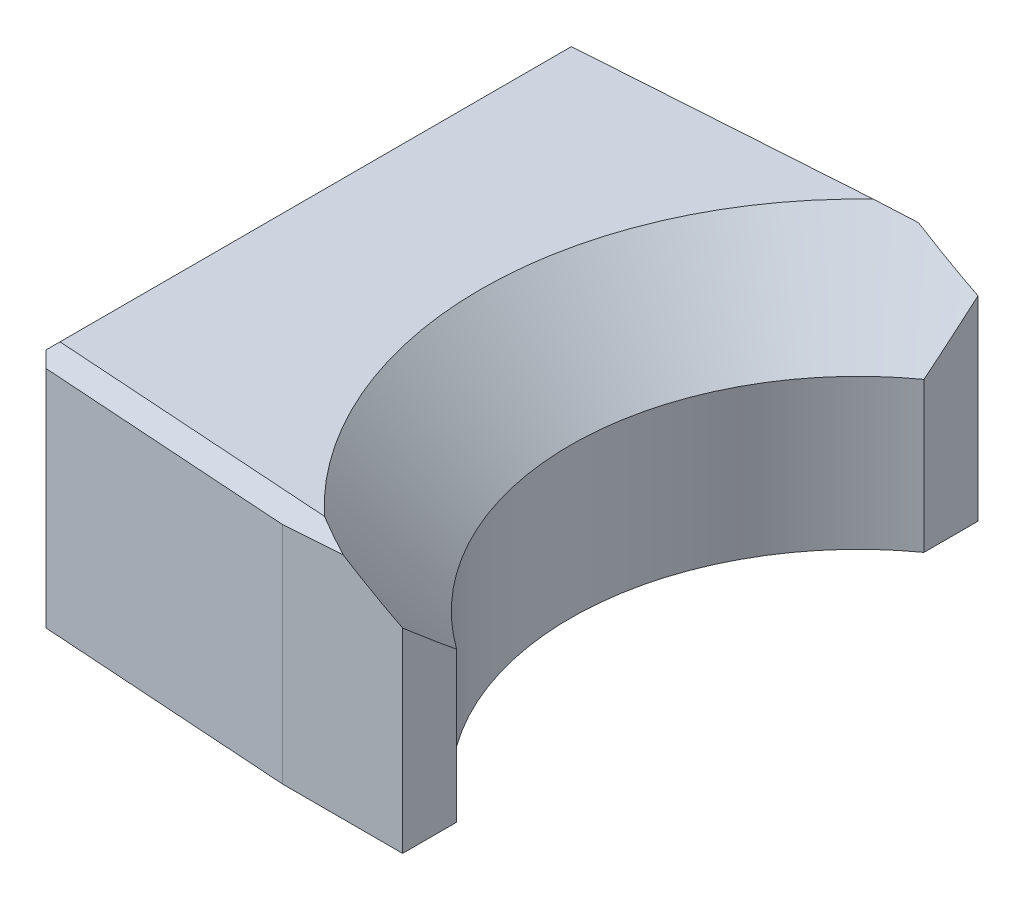
from build123d import *
from OCP.BRepFilletAPI import BRepFilletAPI_MakeChamfer

# Parameters (mm, degrees)
BOSS_EXTRUDE2_DEPTH       = 40
CHAMFER1_SIZE             = 15
CHAMFER3_SIZE             = 2.5
CHAMFER3_SIZE2            = 2.68451721
M4X0_7_TAPPED_HOLE1_D     = 3.3
M4X0_7_TAPPED_HOLE1_DEPTH = 10.1
M4X0_7_TAPPED_HOLE1_TIP   = 0.991420021
SKETCH4_R                 = 11.5
CUT_EXTRUDE1_DEPTH        = 30
M6X1_0_TAPPED_HOLE1_D     = 5
M6X1_0_TAPPED_HOLE1_DEPTH = 15
M6X1_0_TAPPED_HOLE1_TIP   = 1.502151548


with BuildPart() as part:
    # Sketch1 → Boss-Extrude2 (new body)
    with BuildSketch(Plane(origin=(0, 0, 0), x_dir=(1, 0, 0), z_dir=(0, 1, 0))):
        with BuildLine():
            Line((-28, 48), (-48, 48))
            Line((-48, 48), (-93, 45))
            Line((-93, 45), (-93, -45))
            Line((-93, -45), (-48, -48))
            Line((-48, -48), (-28, -48))
            Line((-28, -48), (-28, -38.987177379))
            ThreePointArc((-28, -38.987177379), (-48, 0), (-28, 38.987177379))
            Line((-28, 38.987177379), (-28, 48))
        make_face()
    extrude(amount=BOSS_EXTRUDE2_DEPTH)

    # Chamfer1
    chamfer1_edges = [part.edges().sort_by_distance(p)[0] for p in [
        (-48, 40, 0),
    ]]
    chamfer(chamfer1_edges, length=CHAMFER1_SIZE)

    # Chamfer2
    # the kernel refuses this chamfer: 2.5 mm, written as the material it takes off along each edge
    with BuildSketch(Plane(origin=(-32.604077303, 40, -49.026394846), x_dir=(0.06649386081081782, 0.027495876610587725, 0.9974079121622642), z_dir=(-0.997785157856609, 0, 0.06651901052377412)), Plane(origin=(-108.395922697, 40, 43.973605154), x_dir=(0.06649386081081746, 0.02749587661058773, -0.9974079121622642), z_dir=(0.997785157856609, 0, 0.06651901052377378))) as chamfer2_piece_1:
        with BuildLine():
            Line((2.571682988, 0), (-0.141367887, -2.567794484))
            Line((-0.141367887, -2.567794484), (-0.191348983, -2.56641969))
            ThreePointArc((-0.191348983, -2.56641969), (-0.085323068, -1.283494574), (-0.049981096, 0.001374794))
            Line((-0.049981096, 0.001374794), (0.001374794, 0.049981096))
            ThreePointArc((0.001374794, 0.049981096), (1.286244162, 0.014639124), (2.573057782, 0.049981096))
            Line((2.573057782, 0.049981096), (2.571682988, 0))
        make_face()
    extrude(amount=75.960084991, mode=Mode.SUBTRACT)
    with BuildSketch(Plane(origin=(-93, 40, -60.430097928), x_dir=(0.9996219169112968, 0.027495876610587663, 0), z_dir=(0, 0, 1))) as chamfer2_piece_2:
        with BuildLine():
            Line((2.571682988, 0), (-0.141367887, -2.567794484))
            Line((-0.141367887, -2.567794484), (-0.191348983, -2.56641969))
            ThreePointArc((-0.191348983, -2.56641969), (-0.085323068, -1.283494574), (-0.049981096, 0.001374794))
            Line((-0.049981096, 0.001374794), (0.001374794, 0.049981096))
            ThreePointArc((0.001374794, 0.049981096), (1.286244162, 0.014639124), (2.573057782, 0.049981096))
            Line((2.573057782, 0.049981096), (2.571682988, 0))
        make_face()
    extrude(amount=120.860195856, mode=Mode.SUBTRACT)

    # Chamfer3: one chamfer whose edges measure the first distance from different faces: ONE call of the kernel's chamfer builder (chamfer() names one face for all edges)
    chamfer3_edges_1 = [part.edges().sort_by_distance(p)[0] for p in [
        (-93, 18.75, -45),
    ]]
    chamfer3_side_1 = [part.faces().sort_by_distance(p)[0] for p in [
        (-70.5, 18.75, -46.5),
    ]]
    chamfer3_edges_2 = [part.edges().sort_by_distance(p)[0] for p in [
        (-93, 18.75, 45),
    ]]
    chamfer3_side_2 = [part.faces().sort_by_distance(p)[0] for p in [
        (-93, 18.75, 0),
    ]]
    chamfer3 = BRepFilletAPI_MakeChamfer(part.part.solid().wrapped)
    for e in chamfer3_edges_1:
        chamfer3.Add(CHAMFER3_SIZE, CHAMFER3_SIZE2, e.wrapped, chamfer3_side_1[0].wrapped)  # the first distance lies on this face
    for e in chamfer3_edges_2:
        chamfer3.Add(CHAMFER3_SIZE, CHAMFER3_SIZE2, e.wrapped, chamfer3_side_2[0].wrapped)  # the first distance lies on this face
    add(Compound.cast(chamfer3.Shape()), mode=Mode.REPLACE)

    # M4x0.7 Tapped Hole1
    with Locations(Plane(origin=(-89.5, 0, 41.678571429), x_dir=(0, 0, -1), z_dir=(0, -1, 0))):
        with Locations((0, 0), (-1.410714285, 20.75), (-2.821428571, 41.5), (-2.821428571, 58), (83.357142858, 0), (84.767857143, 20.75), (86.178571429, 41.5), (86.178571429, 58), (41.678571429, 0), (41.678571429, 20), (41.678571429, 35)):
            Hole(M4X0_7_TAPPED_HOLE1_D / 2, depth=M4X0_7_TAPPED_HOLE1_DEPTH)
            with Locations((0, 0, -(M4X0_7_TAPPED_HOLE1_DEPTH + M4X0_7_TAPPED_HOLE1_TIP / 2))):  # 118° drill point
                Cone(0, M4X0_7_TAPPED_HOLE1_D / 2, M4X0_7_TAPPED_HOLE1_TIP, mode=Mode.SUBTRACT)

    # Sketch4 → Cut-Extrude1 (cut)
    with BuildSketch(Plane.ZY.offset(93)):
        with Locations((-19.907741395, 18.75)):
            Circle(SKETCH4_R)
        with Locations(Location((19.907741395, 18.75, 0), (0, 0, 180))):
            Circle(SKETCH4_R)
    extrude(amount=-CUT_EXTRUDE1_DEPTH, mode=Mode.SUBTRACT)

    # M6x1.0 Tapped Hole1
    with Locations(Plane(origin=(-78, 0, 20), x_dir=(0, 0, -1), z_dir=(0, -1, 0))):
        with Locations((0, 0), (40, 0)):
            Hole(M6X1_0_TAPPED_HOLE1_D / 2, depth=M6X1_0_TAPPED_HOLE1_DEPTH)
            with Locations((0, 0, -(M6X1_0_TAPPED_HOLE1_DEPTH + M6X1_0_TAPPED_HOLE1_TIP / 2))):  # 118° drill point
                Cone(0, M6X1_0_TAPPED_HOLE1_D / 2, M6X1_0_TAPPED_HOLE1_TIP, mode=Mode.SUBTRACT)


solid = part.part
